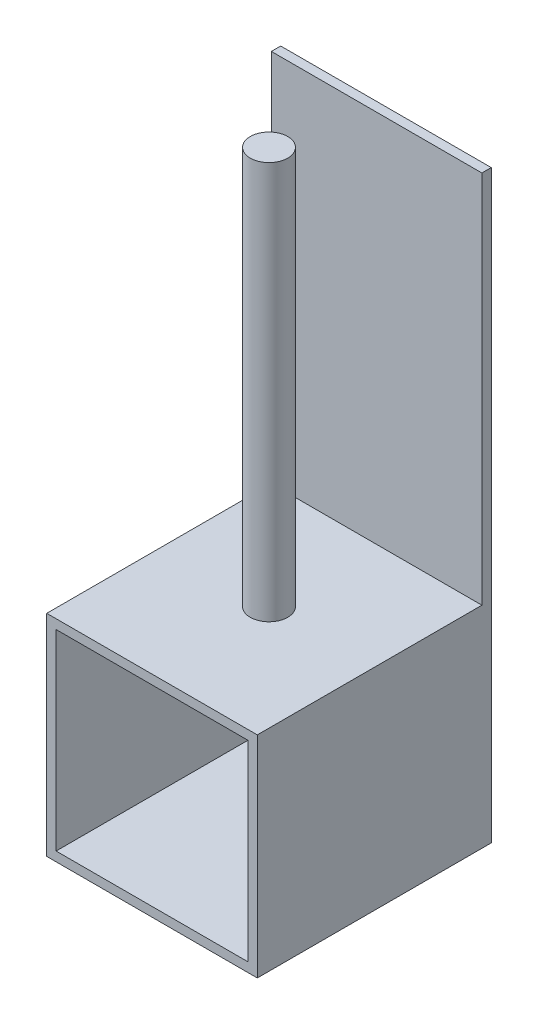
from build123d import *

# Parameters (mm, degrees)
SKETCH1_W           = 45
SKETCH1_H           = 45
SKETCH1_W_2         = 41
SKETCH1_H_2         = 41
BOSS_EXTRUDE1_DEPTH = 50
SKETCH2_W           = 45
SKETCH2_H           = 2
BOSS_EXTRUDE2_DEPTH = 80
SKETCH3_R           = 4
BOSS_EXTRUDE3_DEPTH = 85


with BuildPart() as part:
    # Sketch1 → Boss-Extrude1 (new body)
    with BuildSketch(Plane.XY):
        with Locations((22.5, -22.5)):
            Rectangle(SKETCH1_W, SKETCH1_H)
        with Locations((22.5, -22.5)):
            Rectangle(SKETCH1_W_2, SKETCH1_H_2, mode=Mode.SUBTRACT)
    extrude(amount=BOSS_EXTRUDE1_DEPTH)

    # Sketch2 → Boss-Extrude2 (add)
    with BuildSketch(Plane(origin=(0, 0, 0), x_dir=(1, 0, 0), z_dir=(0, 1, 0))):
        with Locations((22.5, -1)):
            Rectangle(SKETCH2_W, SKETCH2_H)
    extrude(amount=BOSS_EXTRUDE2_DEPTH)

    # Sketch3 → Boss-Extrude3 (add)
    with BuildSketch(Plane(origin=(0, 0, 0), x_dir=(1, 0, 0), z_dir=(0, 1, 0))):
        with Locations((22.5, -25)):
            Circle(SKETCH3_R)
    extrude(amount=BOSS_EXTRUDE3_DEPTH)


solid = part.part
